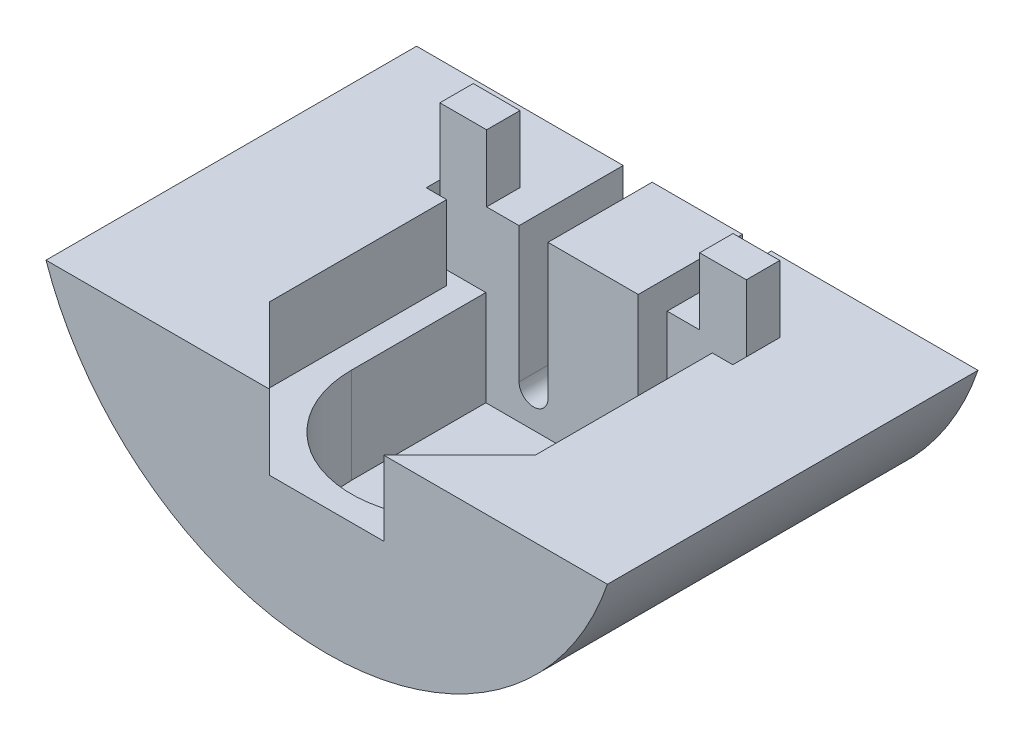
from build123d import *

# Parameters (mm, degrees)
BOSS_EXTRUDE1_DEPTH = 203.2
CAVITY1_START       = -39.91
CAVITY1_DEPTH       = 23.46
CAVITY1_START_2     = -18.031
CAVITY1_2_OUTLINE_W = 6.885
CAVITY1_2_OUTLINE_H = 2.04
CAVITY1_2_OUTLINE_R = 14.28
CAVITY1_2_DEPTH     = 3.581
CAVITY1_START_3     = -19.612
CAVITY1_3_DEPTH     = 3.162
CAVITY1_START_4     = 132.705
CAVITY1_4_OUTLINE_R = 2.1675
CAVITY1_4_DEPTH     = 32.64
CAVITY1_START_5     = 163.305
CAVITY1_5_DEPTH     = 2.04
CAVITY1_6_OUTLINE_R = 2.1675
CAVITY1_6_DEPTH     = 19.992
CAVITY1_7_OUTLINE_R = 2.1675
CAVITY1_7_DEPTH     = 19.992
CUT_EXTRUDE1_DEPTH  = 210.058488467
CUT_EXTRUDE2_DEPTH  = 209.983650662
SKETCH4_W           = 4.335
SKETCH4_H           = 30.6
CUT_EXTRUDE3_DEPTH  = 209.062749189
CUT_EXTRUDE4_DEPTH  = 132.705
CUT_EXTRUDE5_DEPTH  = 15
CUT_EXTRUDE6_DEPTH  = 6
CUT_EXTRUDE7_REACH  = 84.598
SKETCH8_W           = 7
SKETCH8_H           = 5
BOSS_EXTRUDE2_DEPTH = 10
CUT_EXTRUDE8_DEPTH  = 15


with BuildPart() as part:
    # Sketch1 → Boss-Extrude1 (new body)
    with BuildSketch(Plane.XY):
        with BuildLine():
            Line((42.035699114, -14.45), (-42.035699114, -14.45))
            ThreePointArc((-42.035699114, -14.45), (0, -44.45), (42.035699114, -14.45))
        make_face()
    extrude(amount=BOSS_EXTRUDE1_DEPTH)

    # Cavity1: read off the stored shape, not the designer's step
    # Cavity1 outline → Cavity1 (cut)
    with BuildSketch(Plane(origin=(0, 0, 0), x_dir=(1, 0, 0), z_dir=(0, 1, 0)).offset(CAVITY1_START)):
        with BuildLine():
            Line((16.065, -165.345), (16.065, -163.305))
            Line((16.065, -163.305), (-16.065, -163.305))
            Line((-16.065, -163.305), (-16.065, -165.345))
            Line((-16.065, -165.345), (-16.065, -183.45))
            ThreePointArc((-16.065, -183.45), (0, -199.515), (16.065, -183.45))
            Line((16.065, -183.45), (16.065, -165.345))
        make_face()
    extrude(amount=CAVITY1_DEPTH, mode=Mode.SUBTRACT)

    # Cavity1 2 outline → Cavity1 2 (cut)
    with BuildSketch(Plane(origin=(0, 0, 0), x_dir=(1, 0, 0), z_dir=(0, 1, 0)).offset(CAVITY1_START_2)):
        with Locations((19.5075, -164.325)):
            Rectangle(CAVITY1_2_OUTLINE_W, CAVITY1_2_OUTLINE_H)
        with Locations((-19.5075, -164.325)):
            Rectangle(CAVITY1_2_OUTLINE_W, CAVITY1_2_OUTLINE_H)
        with Locations((0, -183.45)):
            Circle(CAVITY1_2_OUTLINE_R)
    extrude(amount=CAVITY1_2_DEPTH, mode=Mode.SUBTRACT)

    # Cavity1 3 outline → Cavity1 3 (cut)
    with BuildSketch(Plane(origin=(0, 0, 0), x_dir=(1, 0, 0), z_dir=(0, 1, 0)).offset(CAVITY1_START_3)):
        with BuildLine():
            Line((19.89, -163.305), (16.065, -163.305))
            Line((16.065, -163.305), (16.065, -183.45))
            ThreePointArc((16.065, -183.45), (0, -199.515), (-16.065, -183.45))
            Line((-16.065, -183.45), (-16.065, -163.305))
            Line((-16.065, -163.305), (-19.89, -163.305))
            Line((-19.89, -163.305), (-19.89, -191.865))
            Line((-19.89, -191.865), (-8.555, -203.2))
            Line((-8.555, -203.2), (8.555, -203.2))
            Line((8.555, -203.2), (19.89, -191.865))
            Line((19.89, -191.865), (19.89, -163.305))
        make_face()
    extrude(amount=CAVITY1_3_DEPTH, mode=Mode.SUBTRACT)

    # Cavity1 4 outline → Cavity1 4 (cut)
    with BuildSketch(Plane.XY.offset(CAVITY1_START_4)):
        with Locations((8.925, -29.71)):
            Circle(CAVITY1_4_OUTLINE_R)
        with Locations((-8.925, -29.71)):
            Circle(CAVITY1_4_OUTLINE_R)
    extrude(amount=CAVITY1_4_DEPTH, mode=Mode.SUBTRACT)

    # Cavity1 5 outline → Cavity1 5 (cut)
    with BuildSketch(Plane.XY.offset(CAVITY1_START_5)):
        Polygon((9.131481481, -14.45), (7.65, -16.45), (16.065, -16.45), (16.065, -14.45), align=None)
        Polygon((-16.065, -16.45), (-7.65, -16.45), (-9.131481481, -14.45), (-16.065, -14.45), align=None)
    extrude(amount=CAVITY1_5_DEPTH, mode=Mode.SUBTRACT)


with BuildPart() as body_2:
    # Cavity1 6 outline → Cavity1 6 (new body)
    with BuildSketch(Plane.XY.offset(CAVITY1_START_5)):
        with Locations((-8.925, -29.71)):
            Circle(CAVITY1_6_OUTLINE_R)
    extrude(amount=CAVITY1_6_DEPTH)


with BuildPart() as body_3:
    # Cavity1 7 outline → Cavity1 7 (new body)
    with BuildSketch(Plane.XY.offset(CAVITY1_START_5)):
        with Locations((8.925, -29.71)):
            Circle(CAVITY1_7_OUTLINE_R)
    extrude(amount=CAVITY1_7_DEPTH)


with BuildPart() as cut_extrude1_tool:
    # Sketch2 → Cut-Extrude1 (new, through all)
    with BuildSketch(Plane(origin=(0, -39.91, 0), x_dir=(1, 0, 0), z_dir=(0, 1, 0))):
        with BuildLine():
            Line((16.065, -183.45), (16.065, -163.305))
            Line((16.065, -163.305), (-16.065, -163.305))
            Line((-16.065, -163.305), (-16.065, -183.45))
            ThreePointArc((-16.065, -183.45), (0, -199.515), (16.065, -183.45))
        make_face()
    extrude(amount=CUT_EXTRUDE1_DEPTH)


with BuildPart() as part_1:
    add(part.part)

    # Cut-Extrude1: cut by cut_extrude1_tool
    add(cut_extrude1_tool.part, mode=Mode.SUBTRACT)

    # Sketch3 → Cut-Extrude2 (cut, through all)
    with BuildSketch(Plane(origin=(0, -19.612, 0), x_dir=(1, 0, 0), z_dir=(0, 1, 0))):
        with BuildLine():
            Line((-8.555, -203.2), (8.555, -203.2))
            Line((8.555, -203.2), (19.89, -191.865))
            Line((19.89, -191.865), (19.89, -163.305))
            Line((19.89, -163.305), (16.065, -163.305))
            Line((16.065, -163.305), (16.065, -183.45))
            ThreePointArc((16.065, -183.45), (0, -199.515), (-16.065, -183.45))
            Line((-16.065, -183.45), (-16.065, -163.305))
            Line((-16.065, -163.305), (-19.89, -163.305))
            Line((-19.89, -163.305), (-19.89, -191.865))
            Line((-19.89, -191.865), (-8.555, -203.2))
        make_face()
    extrude(amount=CUT_EXTRUDE2_DEPTH, mode=Mode.SUBTRACT)

    # Sketch4 → Cut-Extrude3 (cut, through all)
    with BuildSketch(Plane(origin=(0, -29.71, 0), x_dir=(1, 0, 0), z_dir=(0, 1, 0))):
        with Locations((-8.925, -148.005)):
            Rectangle(SKETCH4_W, SKETCH4_H)
        with Locations((8.925, -148.005)):
            Rectangle(SKETCH4_W, SKETCH4_H)
    extrude(amount=CUT_EXTRUDE3_DEPTH, mode=Mode.SUBTRACT)

    # Sketch1<3> → Cut-Extrude4 (cut)
    with BuildSketch(Plane.XY):
        with BuildLine():
            ThreePointArc((44.45, 0), (-7.325151001, 43.842270274), (-42.035699114, -14.45))
            Line((-42.035699114, -14.45), (42.035699114, -14.45))
            ThreePointArc((42.035699114, -14.45), (43.842270274, -7.325151001), (44.45, 0))
        make_face()
        with BuildLine():
            Line((42.035699114, -14.45), (-42.035699114, -14.45))
            ThreePointArc((-42.035699114, -14.45), (0, -44.45), (42.035699114, -14.45))
        make_face()
    extrude(amount=CUT_EXTRUDE4_DEPTH, mode=Mode.SUBTRACT)

    # Sketch5 → Cut-Extrude5 (cut)
    with BuildSketch(Plane(origin=(0, 0, 132.705), x_dir=(-1, 0, 0), z_dir=(0, 0, -1))):
        with BuildLine():
            Line((6.7575, -29.71), (6.7575, -14.45))
            Line((6.7575, -14.45), (-6.7575, -14.45))
            Line((-6.7575, -14.45), (-6.7575, -29.71))
            ThreePointArc((-6.7575, -29.71), (-8.925, -31.8775), (-11.0925, -29.71))
            Line((-11.0925, -29.71), (-11.0925, -14.45))
            Line((-11.0925, -14.45), (-42.035699114, -14.45))
            ThreePointArc((-42.035699114, -14.45), (0, -44.45), (42.035699114, -14.45))
            Line((42.035699114, -14.45), (11.0925, -14.45))
            Line((11.0925, -14.45), (11.0925, -29.71))
            ThreePointArc((11.0925, -29.71), (8.925, -31.8775), (6.7575, -29.71))
        make_face()
    extrude(amount=-CUT_EXTRUDE5_DEPTH, mode=Mode.SUBTRACT)

    # Sketch6 → Cut-Extrude6 (cut, symmetric)
    with BuildSketch(Plane(origin=(0, -19.612, 0), x_dir=(1, 0, 0), z_dir=(0, 1, 0))):
        with BuildLine():
            Line((-16.065, -163.305), (-22.95, -163.305))
            Line((-22.95, -163.305), (-22.95, -165.345))
            Line((-22.95, -165.345), (-19.89, -165.345))
            Line((-19.89, -165.345), (-19.89, -191.865))
            Line((-19.89, -191.865), (-8.555, -203.2))
            Line((-8.555, -203.2), (8.555, -203.2))
            Line((8.555, -203.2), (19.89, -191.865))
            Line((19.89, -191.865), (19.89, -165.345))
            Line((19.89, -165.345), (22.95, -165.345))
            Line((22.95, -165.345), (22.95, -163.305))
            Line((22.95, -163.305), (16.065, -163.305))
            Line((16.065, -163.305), (16.065, -183.45))
            ThreePointArc((16.065, -183.45), (0, -199.515), (-16.065, -183.45))
            Line((-16.065, -183.45), (-16.065, -163.305))
        make_face()
    extrude(amount=CUT_EXTRUDE6_DEPTH, both=True, mode=Mode.SUBTRACT)

    # Sketch7 → Cut-Extrude7 (cut, up to next)
    with BuildSketch(Plane(origin=(0, 0, 147.705), x_dir=(-1, 0, 0), z_dir=(0, 0, -1)), mode=Mode.PRIVATE) as cut_extrude7_sk1:
        with BuildLine():
            Line((-11.0925, -29.71), (-11.0925, -34.71))
            ThreePointArc((-11.0925, -34.71), (-8.925, -36.8775), (-6.7575, -34.71))
            Line((-6.7575, -34.71), (-6.7575, -29.71))
            Line((-6.7575, -29.71), (-11.0925, -29.71))
        make_face()
    cut_extrude7_tool1 = extrude(cut_extrude7_sk1.sketch, amount=-CUT_EXTRUDE7_REACH, mode=Mode.PRIVATE) & part_1.part
    # Sketch7 → Cut-Extrude7 (cut, up to next)
    with BuildSketch(Plane(origin=(0, 0, 147.705), x_dir=(-1, 0, 0), z_dir=(0, 0, -1)), mode=Mode.PRIVATE) as cut_extrude7_sk2:
        with BuildLine():
            Line((11.0925, -29.71), (11.0925, -34.71))
            ThreePointArc((11.0925, -34.71), (8.925, -36.8775), (6.7575, -34.71))
            Line((6.7575, -34.71), (6.7575, -29.71))
            Line((6.7575, -29.71), (11.0925, -29.71))
        make_face()
    cut_extrude7_tool2 = extrude(cut_extrude7_sk2.sketch, amount=-CUT_EXTRUDE7_REACH, mode=Mode.PRIVATE) & part_1.part
    add(cut_extrude7_tool1.solids().sort_by_distance((8.925, -33.078635, 147.705))[0], mode=Mode.SUBTRACT)
    add(cut_extrude7_tool2.solids().sort_by_distance((-8.925, -33.078635, 147.705))[0], mode=Mode.SUBTRACT)

    # Sketch8 → Boss-Extrude2 (add)
    with BuildSketch(Plane(origin=(0, -14.45, 0), x_dir=(1, 0, 0), z_dir=(0, 1, 0))):
        with Locations((-19.45, -160.805)):
            Rectangle(SKETCH8_W, SKETCH8_H)
        with Locations((19.45, -160.805)):
            Rectangle(SKETCH8_W, SKETCH8_H)
    extrude(amount=BOSS_EXTRUDE2_DEPTH)

    # Sketch9 → Cut-Extrude8 (cut)
    with BuildSketch(Plane(origin=(0, 0, 147.705), x_dir=(-1, 0, 0), z_dir=(0, 0, -1))):
        with BuildLine():
            Line((-12, -39.799561914), (-12, -42.799561914))
            ThreePointArc((-12, -42.799561914), (0, -44.45), (12, -42.799561914))
            Line((12, -42.799561914), (12, -39.799561914))
            Line((12, -39.799561914), (16, -39.799561914))
            Line((16, -39.799561914), (16, -37.799561914))
            Line((16, -37.799561914), (-16, -37.799561914))
            Line((-16, -37.799561914), (-16, -39.799561914))
            Line((-16, -39.799561914), (-12, -39.799561914))
        make_face()
    extrude(amount=-CUT_EXTRUDE8_DEPTH, mode=Mode.SUBTRACT)


with BuildPart() as body_2_1:
    add(body_2.part)

    # Cut-Extrude1: cut by cut_extrude1_tool
    add(cut_extrude1_tool.part, mode=Mode.SUBTRACT)


with BuildPart() as body_3_1:
    add(body_3.part)

    # Cut-Extrude1: cut by cut_extrude1_tool
    add(cut_extrude1_tool.part, mode=Mode.SUBTRACT)


solid = part_1.part
